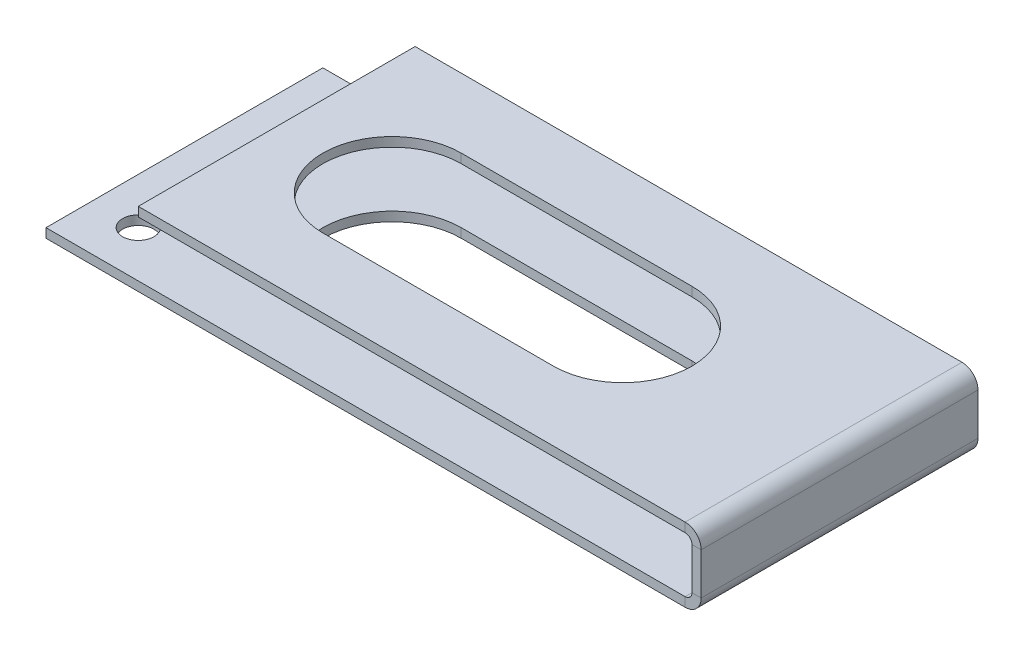
from build123d import *

# Parameters (mm, degrees)
ESQUISSE2_W                           = 60
ESQUISSE2_H                           = 30
T_LE_DE_BASE_PLI_E1_DEPTH             = 1
T_LE_PLI_E_SUR_AR_TE1_STRIP_W         = 5.4732
T_LE_PLI_E_SUR_AR_TE1_STRIP_H         = 1
T_LE_PLI_E_SUR_AR_TE1_STRIP_CUT_DEPTH = 30
T_LE_PLI_E_SUR_AR_TE1_DEPTH           = 30
T_LE_PLI_E_SUR_AR_TE2_STRIP_W         = 5.4732
T_LE_PLI_E_SUR_AR_TE2_STRIP_H         = 1
T_LE_PLI_E_SUR_AR_TE2_STRIP_CUT_DEPTH = 30
T_LE_PLI_E_SUR_AR_TE2_DEPTH           = 30
ENL_V_MAT_EXTRU_1_DEPTH               = 44.462627624
ENL_V_MAT_EXTRU_2_REACH               = 45.463
ESQUISSE27_R                          = 1.7
ESQUISSE29_R                          = 1.7
ENL_V_MAT_EXTRU_3_DEPTH               = 44.289721644


# Sheet-metal steps are written as plain solids
with BuildPart() as part:
    # Esquisse2 → Tôle de base pliée1 (new body)
    with BuildSketch(Plane(origin=(0, 0, 0), x_dir=(1, 0, 0), z_dir=(0, 1, 0))):
        Rectangle(ESQUISSE2_W, ESQUISSE2_H)
    extrude(amount=-T_LE_DE_BASE_PLI_E1_DEPTH)

    # Tôle pliée sur arête1 strip (across the edge) → Tôle pliée sur arête1 strip cut (cut)
    with BuildSketch(Plane(origin=(30, -1, -15), x_dir=(-1, 0, 0), z_dir=(0, 0, 1))):
        with Locations((-2, -0.5)):
            Rectangle(T_LE_PLI_E_SUR_AR_TE1_STRIP_W, T_LE_PLI_E_SUR_AR_TE1_STRIP_H)
    extrude(amount=T_LE_PLI_E_SUR_AR_TE1_STRIP_CUT_DEPTH, mode=Mode.SUBTRACT)

    # Tôle pliée sur arête1 section (across the edge) → Tôle pliée sur arête1 (add)
    with BuildSketch(Plane(origin=(30, -1, -15), x_dir=(-1, 0, 0), z_dir=(0, 0, 1))):
        with BuildLine():
            Line((-1, 0.7366), (-1, 6))
            Line((-1, 6), (0, 6))
            Line((0, 6), (0, 0.7366))
            ThreePointArc((0, 0.7366), (0.215745145, 0.215745145), (0.7366, 0))
            Line((0.7366, 0), (0.7366, -1))
            ThreePointArc((0.7366, -1), (-0.491361636, -0.491361636), (-1, 0.7366))
        make_face()
    extrude(amount=T_LE_PLI_E_SUR_AR_TE1_DEPTH)

    # Tôle pliée sur arête2 strip (across the edge) → Tôle pliée sur arête2 strip cut (cut)
    with BuildSketch(Plane(origin=(30, -7, -15), x_dir=(0, 1, 0), z_dir=(0, 0, 1))):
        with Locations((-2, -0.5)):
            Rectangle(T_LE_PLI_E_SUR_AR_TE2_STRIP_W, T_LE_PLI_E_SUR_AR_TE2_STRIP_H)
    extrude(amount=T_LE_PLI_E_SUR_AR_TE2_STRIP_CUT_DEPTH, mode=Mode.SUBTRACT)

    # Tôle pliée sur arête2 section (across the edge) → Tôle pliée sur arête2 (add)
    with BuildSketch(Plane(origin=(30, -7, -15), x_dir=(0, 1, 0), z_dir=(0, 0, 1))):
        with BuildLine():
            Line((-1, 0.7366), (-1, 70))
            Line((-1, 70), (0, 70))
            Line((0, 70), (0, 0.7366))
            ThreePointArc((0, 0.7366), (0.215745145, 0.215745145), (0.7366, 0))
            Line((0.7366, 0), (0.7366, -1))
            ThreePointArc((0.7366, -1), (-0.491361636, -0.491361636), (-1, 0.7366))
        make_face()
    extrude(amount=T_LE_PLI_E_SUR_AR_TE2_DEPTH)

    # Esquisse26 → Enlèv. mat.-Extru.1 (cut, through all)
    with BuildSketch(Plane(origin=(0, 0, 0), x_dir=(1, 0, 0), z_dir=(0, 1, 0))):
        with BuildLine():
            Line((-17.5, 7.5), (7.5, 7.5))
            ThreePointArc((7.5, 7.5), (15, 0), (7.5, -7.5))
            Line((7.5, -7.5), (-17.5, -7.5))
            ThreePointArc((-17.5, -7.5), (-25, 0), (-17.5, 7.5))
        make_face()
    extrude(amount=-ENL_V_MAT_EXTRU_1_DEPTH, mode=Mode.SUBTRACT)

    # Esquisse27 → Enlèv. mat.-Extru.2 (cut, up to next)
    with BuildSketch(Plane(origin=(0, -8, 0), x_dir=(1, 0, 0), z_dir=(0, 1, 0)), mode=Mode.PRIVATE) as enl_v_mat_extru_2_sk1:
        with Locations(Location((-35, 10, 0), (0, 0, 180))):
            Circle(ESQUISSE27_R)
    enl_v_mat_extru_2_tool1 = extrude(enl_v_mat_extru_2_sk1.sketch, amount=ENL_V_MAT_EXTRU_2_REACH, mode=Mode.PRIVATE) & part.part
    # Esquisse27 → Enlèv. mat.-Extru.2 (cut, up to next)
    with BuildSketch(Plane(origin=(0, -8, 0), x_dir=(1, 0, 0), z_dir=(0, 1, 0)), mode=Mode.PRIVATE) as enl_v_mat_extru_2_sk2:
        with Locations((-35, -10)):
            Circle(ESQUISSE27_R)
    enl_v_mat_extru_2_tool2 = extrude(enl_v_mat_extru_2_sk2.sketch, amount=ENL_V_MAT_EXTRU_2_REACH, mode=Mode.PRIVATE) & part.part
    add(enl_v_mat_extru_2_tool1.solids().sort_by_distance((-35, -8, -10))[0], mode=Mode.SUBTRACT)
    add(enl_v_mat_extru_2_tool2.solids().sort_by_distance((-35, -8, 10))[0], mode=Mode.SUBTRACT)

    # Esquisse29 → Enlèv. mat.-Extru.3 (cut, through all)
    with BuildSketch(Plane(origin=(0, -7, 0), x_dir=(1, 0, 0), z_dir=(0, 1, 0))):
        with Locations(Location((26, 0, 0), (0, 0, 180))):
            Circle(ESQUISSE29_R)
    extrude(amount=-ENL_V_MAT_EXTRU_3_DEPTH, mode=Mode.SUBTRACT)


solid = part.part
